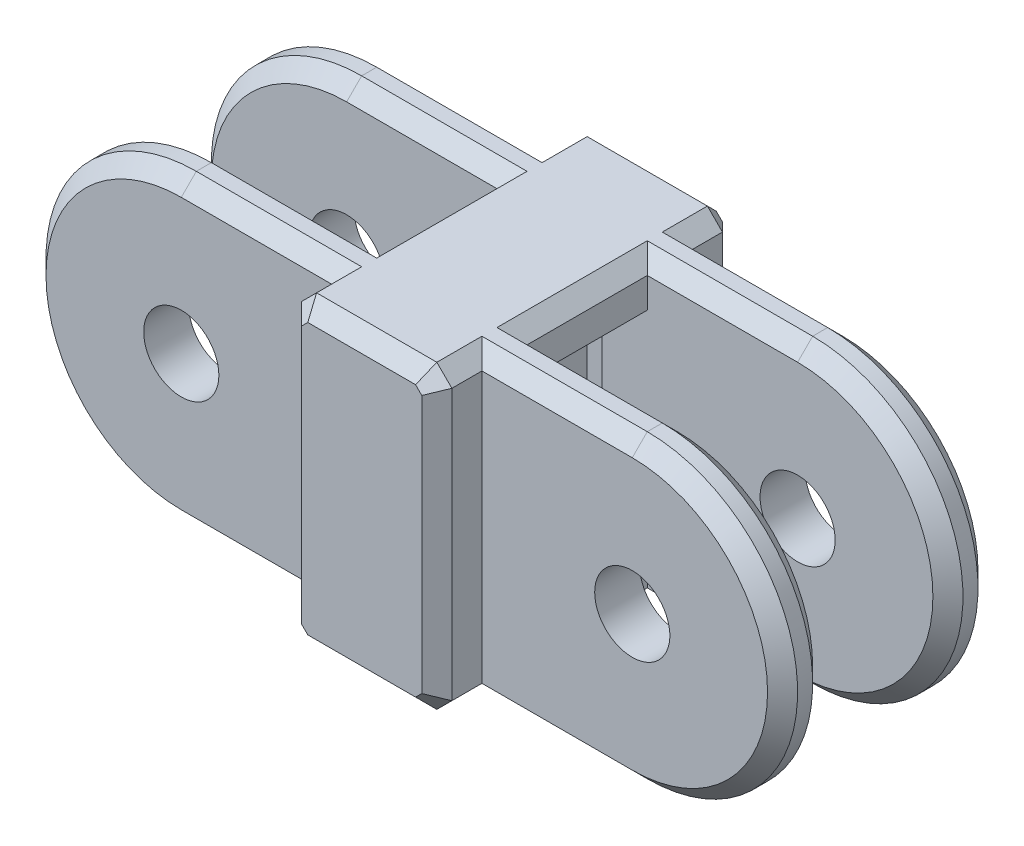
from build123d import *

# Parameters (mm, degrees)
BOSS_EXTRUDE1_DEPTH = 10
CUT_EXTRUDE1_DEPTH  = 4
CUT_EXTRUDE2_START  = -7
CUT_EXTRUDE2_DEPTH  = 7
CUT_EXTRUDE3_START  = 14
CUT_EXTRUDE3_DEPTH  = 7
SKETCH3_R           = 2.5
CUT_EXTRUDE4_DEPTH  = 10
CHAMFER2_SIZE       = 1
CHAMFER3_SIZE       = 1
CHAMFER4_SIZE       = 1
SHELL1_START        = -4
SHELL1_OUTLINE_W    = 10
SHELL1_OUTLINE_H    = 14
SHELL1_DEPTH        = 8
SHELL1_START_2      = -7
SHELL1_2_OUTLINE_W  = 4
SHELL1_2_OUTLINE_H  = 14
SHELL1_2_DEPTH      = 14
CHAMFER5_SIZE       = 1


# Read off the part's stored shape, not the designer's step: Shell1
with BuildPart() as part:
    # Sketch1 → Boss-Extrude1 (new, symmetric)
    with BuildSketch(Plane.XY):
        with BuildLine():
            Line((-15, 10), (15, 10))
            ThreePointArc((15, 10), (25, 0), (15, -10))
            Line((15, -10), (-15, -10))
            ThreePointArc((-15, -10), (-25, 0), (-15, 10))
        make_face()
    extrude(amount=BOSS_EXTRUDE1_DEPTH, both=True)

    # Sketch2 → Cut-Extrude1 (cut, symmetric)
    with BuildSketch(Plane.XY):
        with BuildLine():
            Line((-15, 10), (-5, 10))
            Line((-5, 10), (-5, -10))
            Line((-5, -10), (-15, -10))
            ThreePointArc((-15, -10), (-25, 0), (-15, 10))
        make_face()
        with BuildLine():
            Line((5, -10), (15, -10))
            ThreePointArc((15, -10), (25, 0), (15, 10))
            Line((15, 10), (5, 10))
            Line((5, 10), (5, -10))
        make_face()
    extrude(amount=CUT_EXTRUDE1_DEPTH, both=True, mode=Mode.SUBTRACT)

    # Sketch2<2> → Cut-Extrude2 (cut)
    with BuildSketch(Plane.XY.offset(CUT_EXTRUDE2_START)):
        with BuildLine():
            Line((-15, 10), (-5, 10))
            Line((-5, 10), (-5, -10))
            Line((-5, -10), (-15, -10))
            ThreePointArc((-15, -10), (-25, 0), (-15, 10))
        make_face()
        with BuildLine():
            Line((5, -10), (15, -10))
            ThreePointArc((15, -10), (25, 0), (15, 10))
            Line((15, 10), (5, 10))
            Line((5, 10), (5, -10))
        make_face()
    extrude(amount=-CUT_EXTRUDE2_DEPTH, mode=Mode.SUBTRACT)

    # Sketch2<3> → Cut-Extrude3 (cut)
    with BuildSketch(Plane.XY.offset(CUT_EXTRUDE3_START)):
        with BuildLine():
            Line((-15, 10), (-5, 10))
            Line((-5, 10), (-5, -10))
            Line((-5, -10), (-15, -10))
            ThreePointArc((-15, -10), (-25, 0), (-15, 10))
        make_face()
        with BuildLine():
            Line((5, -10), (15, -10))
            ThreePointArc((15, -10), (25, 0), (15, 10))
            Line((15, 10), (5, 10))
            Line((5, 10), (5, -10))
        make_face()
    extrude(amount=-CUT_EXTRUDE3_DEPTH, mode=Mode.SUBTRACT)

    # Sketch3 → Cut-Extrude4 (cut, symmetric)
    with BuildSketch(Plane.XY):
        with Locations((-15, 0)):
            Circle(SKETCH3_R)
        with Locations(Location((15, 0, 0), (0, 0, 180))):
            Circle(SKETCH3_R)
    extrude(amount=CUT_EXTRUDE4_DEPTH, both=True, mode=Mode.SUBTRACT)

    # Chamfer2
    chamfer2_edges = [part.edges().sort_by_distance(p)[0] for p in [
        (10, -10, 7),
        (-25, 0, -4),
        (-10, 10, -4),
        (-10, -10, -4),
        (-25, 0, 4),
        (-10, -10, 4),
        (-10, 10, 4),
        (25, 0, -4),
        (10, -10, -4),
        (10, 10, -4),
        (25, 0, 4),
        (10, 10, 4),
        (10, -10, 4),
        (-25, 0, -7),
        (-10, -10, -7),
        (-10, 10, -7),
        (25, 0, -7),
        (10, 10, -7),
        (10, -10, -7),
        (-25, 0, 7),
        (-10, -10, 7),
        (-10, 10, 7),
        (25, 0, 7),
        (10, 10, 7),
    ]]
    chamfer(chamfer2_edges, length=CHAMFER2_SIZE)

    # Chamfer3
    chamfer3_edges = [part.edges().sort_by_distance(p)[0] for p in [
        (-5, -10, -8),
        (5, -10, -8),
        (5, -10, 8),
        (-5, -10, 8),
        (-5, 10, 8),
        (5, 10, 8),
        (5, 10, -8),
        (-5, 10, -8),
    ]]
    chamfer(chamfer3_edges, length=CHAMFER3_SIZE)

    # Chamfer4
    chamfer4_edges = [part.edges().sort_by_distance(p)[0] for p in [
        (-5, 0, -10),
        (0, -10, 10),
        (0, -10, -10),
        (0, 10, -10),
        (5, 0, -10),
        (-4.5, 9.5, -10),
        (4.5, 9.5, -10),
        (4.5, -9.5, -10),
        (-4.5, -9.5, -10),
        (5, 0, 10),
        (0, 10, 10),
        (-5, 0, 10),
        (4.5, 9.5, 10),
        (-4.5, 9.5, 10),
        (-4.5, -9.5, 10),
        (4.5, -9.5, 10),
    ]]
    chamfer(chamfer4_edges, length=CHAMFER4_SIZE)

    # Shell1 outline → Shell1 (cut)
    with BuildSketch(Plane.XY.offset(SHELL1_START)):
        Rectangle(SHELL1_OUTLINE_W, SHELL1_OUTLINE_H)
    extrude(amount=SHELL1_DEPTH, mode=Mode.SUBTRACT)

    # Shell1 2 outline → Shell1 2 (cut)
    with BuildSketch(Plane.XY.offset(SHELL1_START_2)):
        Rectangle(SHELL1_2_OUTLINE_W, SHELL1_2_OUTLINE_H)
    extrude(amount=SHELL1_2_DEPTH, mode=Mode.SUBTRACT)

    # Chamfer5
    chamfer5_edges = [part.edges().sort_by_distance(p)[0] for p in [
        (5, -10, 0),
        (-5, -10, 0),
        (5, 10, 0),
        (-5, 10, 0),
    ]]
    chamfer(chamfer5_edges, length=CHAMFER5_SIZE)


solid = part.part
